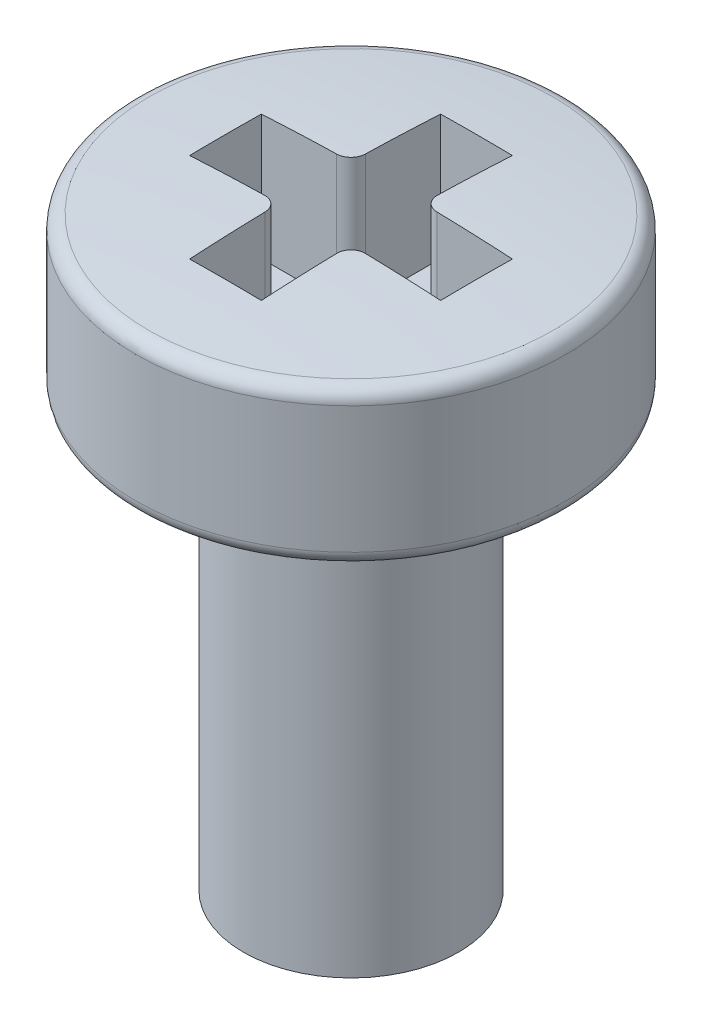
from build123d import *

# Parameters (mm, degrees)
CROQUIS1_R              = 1.5
SALIENTE_EXTRUIR1_DEPTH = 6
CORTAR_EXTRUIR1_DEPTH   = 2.5


with BuildPart() as part:
    # Croquis1 → Saliente-Extruir1 (new body)
    with BuildSketch(Plane(origin=(0, 0, 0), x_dir=(1, 0, 0), z_dir=(0, 1, 0))):
        Circle(CROQUIS1_R)
    extrude(amount=SALIENTE_EXTRUIR1_DEPTH)

    # Croquis4 → Revolución1 (revolve)
    with BuildSketch(Plane.XY):
        with BuildLine():
            Line((0, 6), (2.8, 6))
            ThreePointArc((2.8, 6), (2.941421356, 6.058578644), (3, 6.2))
            Line((3, 6.2), (3, 7.968164756))
            ThreePointArc((3, 7.968164756), (2.947916174, 8.102778297), (2.818791946, 8.167279956))
            ThreePointArc((2.818791946, 8.167279956), (1.410957356, 8.26680162), (0, 8.3))
            Line((0, 8.3), (0, 6))
        make_face()
    revolve(axis=Axis((0, 6, 0), (0, 1, 0)))

    # Croquis5 → Cortar-Extruir1 (cut)
    with BuildSketch(Plane(origin=(0, 9, 0), x_dir=(1, 0, 0), z_dir=(0, 1, 0))):
        with BuildLine():
            Line((-0.5, -0.7), (-0.5, -1.75))
            Line((-0.5, -1.75), (0.5, -1.75))
            Line((0.5, -1.75), (0.5, -0.7))
            ThreePointArc((0.5, -0.7), (0.558578644, -0.558578644), (0.7, -0.5))
            Line((0.7, -0.5), (1.75, -0.5))
            Line((1.75, -0.5), (1.75, 0.5))
            Line((1.75, 0.5), (0.7, 0.5))
            ThreePointArc((0.7, 0.5), (0.558578644, 0.558578644), (0.5, 0.7))
            Line((0.5, 0.7), (0.5, 1.75))
            Line((0.5, 1.75), (-0.5, 1.75))
            Line((-0.5, 1.75), (-0.5, 0.7))
            ThreePointArc((-0.5, 0.7), (-0.558578644, 0.558578644), (-0.7, 0.5))
            Line((-0.7, 0.5), (-1.75, 0.5))
            Line((-1.75, 0.5), (-1.75, -0.5))
            Line((-1.75, -0.5), (-0.7, -0.5))
            ThreePointArc((-0.7, -0.5), (-0.558578644, -0.558578644), (-0.5, -0.7))
        make_face()
    extrude(amount=-CORTAR_EXTRUIR1_DEPTH, mode=Mode.SUBTRACT)


solid = part.part
